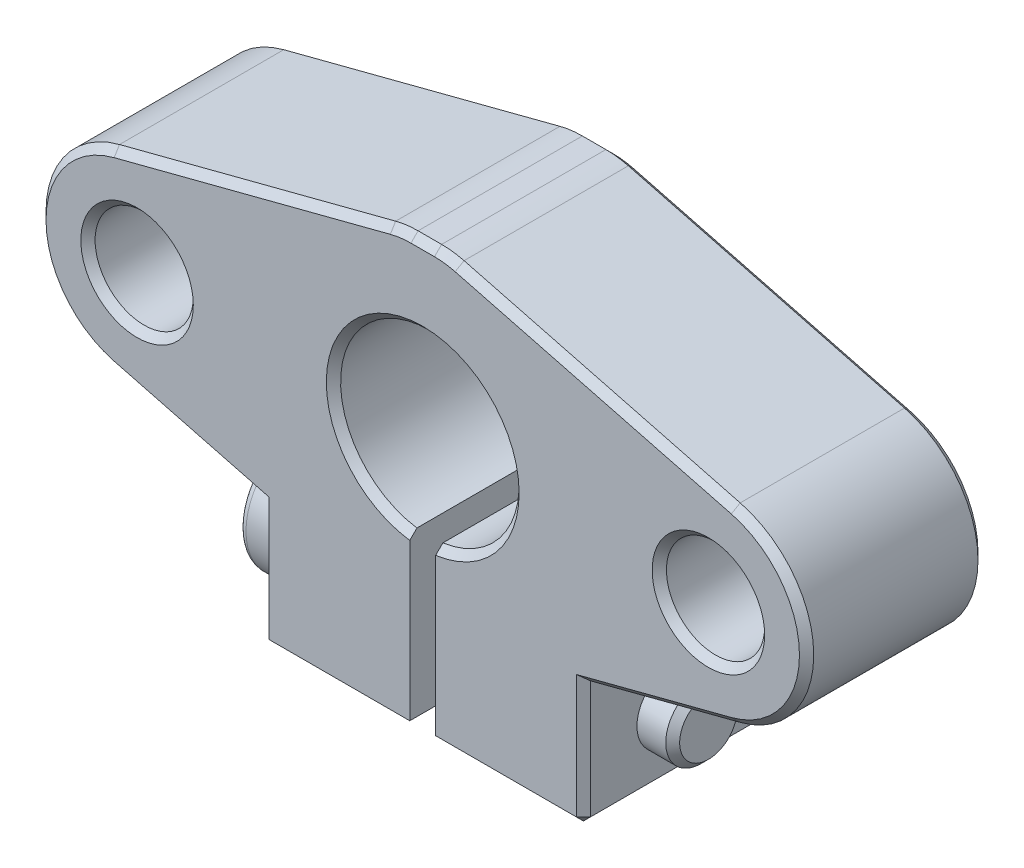
from build123d import *

# Parameters (mm, degrees)
SKETCH_2_R          = 2.75
EXTRUDE_1_DEPTH     = 10
FILLET_1_R          = 5
CHAMFER_1_SIZE      = 0.4
CUT_EXTRUDE_3_REACH = 29.794
SKETCH_4_R          = 2
CUT_EXTRUDE_1_DEPTH = 36.220732531
FILLET_2_R          = 0.4
CUT_EXTRUDE_4_DEPTH = 2.5
CHAMFER_2_SIZE      = 0.4


with BuildPart() as part:
    # Эскиз2 → Бобышка-Вытянуть1 (new body)
    with BuildSketch(Plane.XY):
        with BuildLine():
            Line((17.382284837, 5.323465848), (1.29758483, 9.5))
            Line((1.29758483, 9.5), (-1.29758483, 9.5))
            Line((-1.29758483, 9.5), (-17.382284837, 5.323465848))
            ThreePointArc((-17.382284837, 5.323465848), (-21.5, 0), (-17.382284837, -5.323465848))
            Line((-17.382284837, -5.323465848), (-9, -7.5))
            Line((-9, -7.5), (-9, -14.5))
            Line((-9, -14.5), (-0.725, -14.5))
            Line((-0.725, -14.5), (-0.725, -4.947158275))
            ThreePointArc((-0.725, -4.947158275), (0, 5), (0.725, -4.947158275))
            Line((0.725, -4.947158275), (0.725, -14.5))
            Line((0.725, -14.5), (9, -14.5))
            Line((9, -14.5), (9, -7.5))
            Line((9, -7.5), (17.382284837, -5.323465848))
            ThreePointArc((17.382284837, -5.323465848), (21.5, 0), (17.382284837, 5.323465848))
        make_face()
        with Locations((16, 0)):
            Circle(SKETCH_2_R, mode=Mode.SUBTRACT)
        with Locations((-16, 0)):
            Circle(SKETCH_2_R, mode=Mode.SUBTRACT)
    extrude(amount=EXTRUDE_1_DEPTH)

    # Скругление1
    fillet_1_edges = [part.edges().sort_by_distance(p)[0] for p in [
        (-1.29758483, 9.5, 5),
        (1.29758483, 9.5, 5),
    ]]
    fillet(fillet_1_edges, radius=FILLET_1_R)

    # Фаска1
    chamfer_1_edges = [part.edges().sort_by_distance(p)[0] for p in [
        (-18.75, 0, 10),
        (13.25, 0, 10),
        (0.725, -14.5, 5),
        (9, -14.5, 5),
        (-9, -14.5, 5),
        (-21.5, 0, 0),
        (-13.191142418, -6.411732924, 0),
        (-4.8625, -14.5, 0),
        (-9.6489665, 7.331490127, 0),
        (0, 9.5, 0),
        (9.6489665, 7.331490127, 0),
        (21.5, 0, 0),
        (13.191142418, -6.411732924, 0),
        (4.8625, -14.5, 0),
        (0, 5, 0),
        (-0.725, -14.5, 5),
        (0, 9.5, 10),
        (9.6489665, 7.331490127, 10),
        (21.5, 0, 10),
        (13.191142418, -6.411732924, 10),
        (9, -11, 10),
        (4.8625, -14.5, 10),
        (0, 5, 10),
        (-4.8625, -14.5, 10),
        (-13.191142418, -6.411732924, 10),
        (-21.5, 0, 10),
        (-9.6489665, 7.331490127, 10),
        (-1.292440127, 9.459716324, 0),
        (1.292440127, 9.459716324, 0),
        (1.292440127, 9.459716324, 10),
        (-1.292440127, 9.459716324, 10),
        (-9, -11, 10),
        (-18.75, 0, 0),
        (13.25, 0, 0),
    ]]
    chamfer(chamfer_1_edges, length=CHAMFER_1_SIZE)

    # Эскиз6 → Вырез-Вытянуть3 (cut, up to next)
    with BuildSketch(Plane.XY.offset(10), mode=Mode.PRIVATE) as cut_extrude_3_sk1:
        Polygon((-8.6, -11), (-10.253715484, -10.04522692), (-10.253715484, -11.95477308), align=None)
    cut_extrude_3_tool1 = extrude(cut_extrude_3_sk1.sketch, amount=-CUT_EXTRUDE_3_REACH, mode=Mode.PRIVATE) & part.part
    add(cut_extrude_3_tool1.solids().sort_by_distance((-9.702477, -11, 10))[0], mode=Mode.SUBTRACT)

    # Эскиз4 → Вырез-Вытянуть1 (cut, through all)
    with BuildSketch(Plane.ZY.offset(9)):
        with Locations((5, -11)):
            Circle(SKETCH_4_R)
    extrude(amount=-CUT_EXTRUDE_1_DEPTH, mode=Mode.SUBTRACT)


with BuildPart() as body_2:
    # Эскиз7 → Повернуть1 (revolve)
    with BuildSketch(Plane.XY.offset(5)):
        Polygon((-11.8, -11), (-11.8, -7.5), (-9, -7.5), (-9, -9), (10.61, -9), (11, -9.39), (11, -11), align=None)
    revolve(axis=Axis((11, -11, 5), (-1, 0, 0)))

    # Скругление2
    fillet_2_edges = [body_2.edges().sort_by_distance(p)[0] for p in [
        (-11.8, -14.5, 5),
    ]]
    fillet(fillet_2_edges, radius=FILLET_2_R)

    # Эскиз8 → Вырез-Вытянуть4 (cut)
    with BuildSketch(Plane.ZY.offset(11.8)):
        Polygon((5, -9.267949192), (3.5, -10.133974596), (3.5, -11.866025404), (5, -12.732050808), (6.5, -11.866025404), (6.5, -10.133974596), align=None)
    extrude(amount=-CUT_EXTRUDE_4_DEPTH, mode=Mode.SUBTRACT)

    # Фаска2
    chamfer_2_edges = [body_2.edges().sort_by_distance(p)[0] for p in [
        (-11.8, -9.700961894, 4.25),
        (-11.8, -11, 3.5),
        (-11.8, -12.299038106, 4.25),
        (-11.8, -12.299038106, 5.75),
        (-11.8, -11, 6.5),
        (-11.8, -9.700961894, 5.75),
        (-9.3, -11, 6.5),
        (-9.3, -12.299038106, 5.75),
        (-9.3, -12.299038106, 4.25),
        (-9.3, -11, 3.5),
        (-9.3, -9.700961894, 4.25),
        (-9.3, -9.700961894, 5.75),
    ]]
    chamfer(chamfer_2_edges, length=CHAMFER_2_SIZE)


solid = Compound([part.part, body_2.part])
